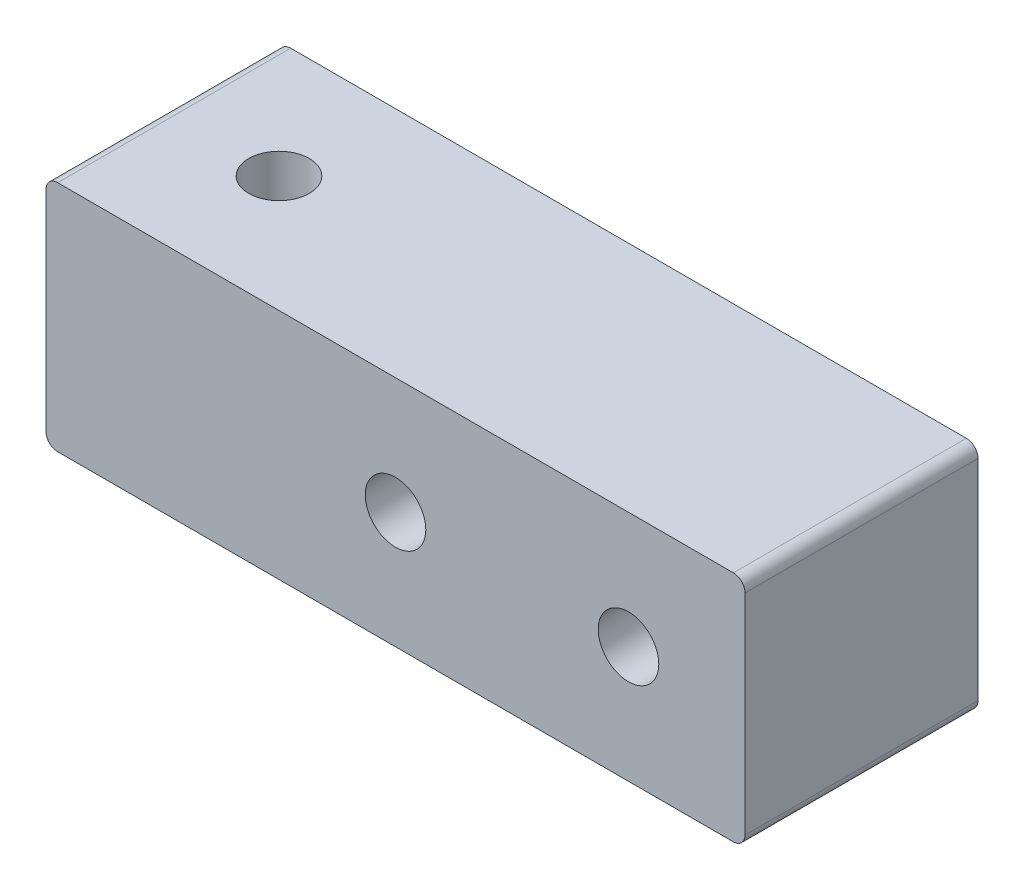
from build123d import *

# Parameters (mm, degrees)
SKETCH_1_W          = 30
SKETCH_1_H          = 10
EXTRUDE_1_DEPTH     = 10
SKETCH_2_R          = 1.3
CUT_EXTRUDE_1_DEPTH = 34.166247904
SKETCH_3_R          = 1.3
CUT_EXTRUDE_2_DEPTH = 34.166247904
FILLET_1_R          = 0.5


with BuildPart() as part:
    # ｽｹｯﾁ1 → ﾎﾞｽ - 押し出し1 (new body)
    with BuildSketch(Plane.XY):
        with Locations((15, 5)):
            Rectangle(SKETCH_1_W, SKETCH_1_H)
    extrude(amount=EXTRUDE_1_DEPTH)

    # ｽｹｯﾁ2 → ｶｯﾄ - 押し出し1 (cut, through all)
    with BuildSketch(Plane(origin=(0, 10, 0), x_dir=(1, 0, 0), z_dir=(0, 1, 0))):
        with Locations((5, -5)):
            Circle(SKETCH_2_R)
    extrude(amount=-CUT_EXTRUDE_1_DEPTH, mode=Mode.SUBTRACT)

    # ｽｹｯﾁ3 → ｶｯﾄ - 押し出し2 (cut, through all)
    with BuildSketch(Plane.XY.offset(10)):
        with Locations((15, 5)):
            Circle(SKETCH_3_R)
        with Locations((25, 5)):
            Circle(SKETCH_3_R)
    extrude(amount=-CUT_EXTRUDE_2_DEPTH, mode=Mode.SUBTRACT)

    # ﾌｨﾚｯﾄ1
    fillet_1_edges = [part.edges().sort_by_distance(p)[0] for p in [
        (30, 0, 5),
        (0, 0, 5),
        (30, 10, 5),
        (0, 10, 5),
    ]]
    fillet(fillet_1_edges, radius=FILLET_1_R)


solid = part.part
